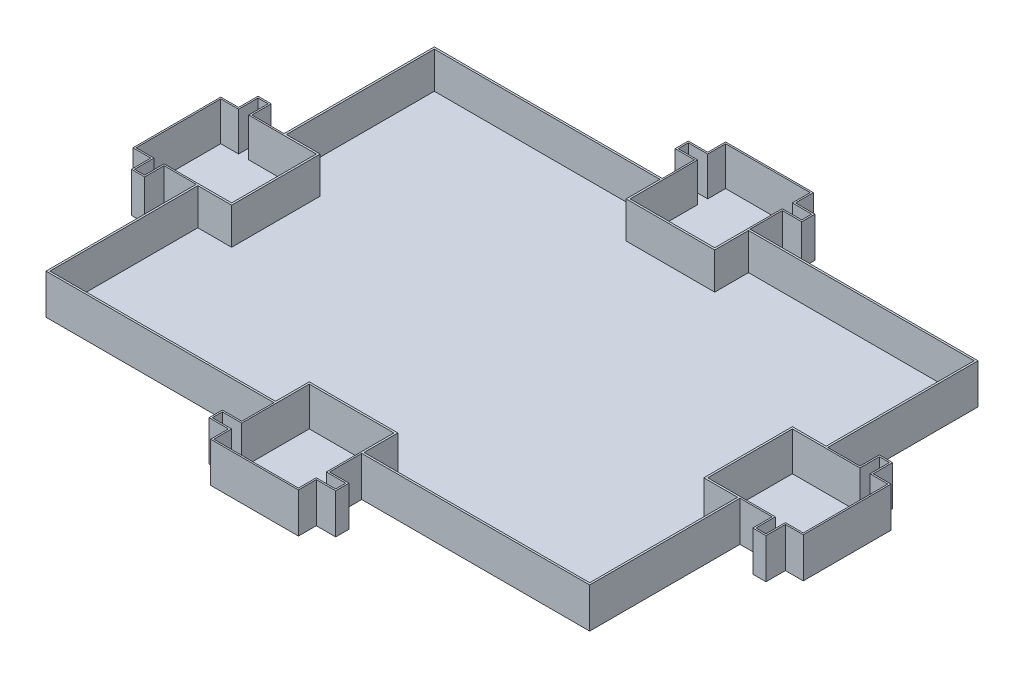
from build123d import *

# Parameters (mm, degrees)
SALIENTE_EXTRUIR1_DEPTH = 10
VACIADO2_START          = -40.8
VACIADO2_OUTLINE_W      = 121.6
VACIADO2_OUTLINE_H      = 9.4
VACIADO2_DEPTH          = 81.6
VACIADO2_START_2        = -49.5
VACIADO2_2_OUTLINE_W    = 49.4
VACIADO2_2_OUTLINE_H    = 9.4
VACIADO2_2_DEPTH        = 99
VACIADO2_3_OUTLINE_W    = 8.7
VACIADO2_3_OUTLINE_H    = 9.4
VACIADO2_3_DEPTH        = 38.1
VACIADO2_START_3        = 11.4
VACIADO2_4_OUTLINE_W    = 8.7
VACIADO2_4_OUTLINE_H    = 9.4
VACIADO2_4_DEPTH        = 38.1
SALIENTE_EXTRUIR6_DEPTH = 0.3


# Read off the part's stored shape, not the designer's step: Vaciado2
with BuildPart() as part:
    # Croquis1 → Saliente-Extruir1 (new body)
    with BuildSketch(Plane(origin=(0, 0, 0), x_dir=(1, 0, 0), z_dir=(0, 1, 0))):
        Polygon((-11.3, -50), (-11.3, -58.3), (-16.3, -58.3), (-16.3, -61.7), (-11.3, -61.7), (-11.3, -66.3), (11.3, -66.3), (11.3, -61.7), (16.3, -61.7), (16.3, -58.3), (11.3, -58.3), (11.3, -50), (70, -50), (70, -11.3), (78.3, -11.3), (78.3, -16.3), (81.7, -16.3), (81.7, -11.3), (86.3, -11.3), (86.3, 11.3), (81.7, 11.3), (81.7, 16.3), (78.3, 16.3), (78.3, 11.3), (70, 11.3), (70, 50), (11.3, 50), (11.3, 58.3), (16.3, 58.3), (16.3, 61.7), (11.3, 61.7), (11.3, 66.3), (-11.3, 66.3), (-11.3, 61.7), (-16.3, 61.7), (-16.3, 58.3), (-11.3, 58.3), (-11.3, 50), (-70, 50), (-70, 11.3), (-78.3, 11.3), (-78.3, 16.3), (-81.7, 16.3), (-81.7, 11.3), (-86.3, 11.3), (-86.3, -11.3), (-81.7, -11.3), (-81.7, -16.3), (-78.3, -16.3), (-78.3, -11.3), (-70, -11.3), (-70, -50), align=None)
        Polygon((-10.9, 41.3), (-10.9, 58.7), (-15.9, 58.7), (-15.9, 61.3), (-10.9, 61.3), (-10.9, 65.9), (10.9, 65.9), (10.9, 61.3), (15.9, 61.3), (15.9, 58.7), (10.9, 58.7), (10.9, 41.3), align=None, mode=Mode.SUBTRACT)
        Polygon((-10.9, -41.3), (10.9, -41.3), (10.9, -58.7), (15.9, -58.7), (15.9, -61.3), (10.9, -61.3), (10.9, -65.9), (-10.9, -65.9), (-10.9, -61.3), (-15.9, -61.3), (-15.9, -58.7), (-10.9, -58.7), align=None, mode=Mode.SUBTRACT)
        Polygon((-61.3, -10.9), (-78.7, -10.9), (-78.7, -15.9), (-81.3, -15.9), (-81.3, -10.9), (-85.9, -10.9), (-85.9, 10.9), (-81.3, 10.9), (-81.3, 15.9), (-78.7, 15.9), (-78.7, 10.9), (-61.3, 10.9), align=None, mode=Mode.SUBTRACT)
        Polygon((61.3, -10.9), (61.3, 10.9), (78.7, 10.9), (78.7, 15.9), (81.3, 15.9), (81.3, 10.9), (85.9, 10.9), (85.9, -10.9), (81.3, -10.9), (81.3, -15.9), (78.7, -15.9), (78.7, -10.9), align=None, mode=Mode.SUBTRACT)
    extrude(amount=-SALIENTE_EXTRUIR1_DEPTH)

    # Vaciado2 outline → Vaciado2 (cut)
    with BuildSketch(Plane.XY.offset(VACIADO2_START)):
        with Locations((0, -4.7)):
            Rectangle(VACIADO2_OUTLINE_W, VACIADO2_OUTLINE_H)
    extrude(amount=VACIADO2_DEPTH, mode=Mode.SUBTRACT)

    # Vaciado2 2 outline → Vaciado2 2 (cut)
    with BuildSketch(Plane.XY.offset(VACIADO2_START_2)):
        with Locations((-36.1, -4.7)):
            Rectangle(VACIADO2_2_OUTLINE_W, VACIADO2_2_OUTLINE_H)
        with Locations((36.1, -4.7)):
            Rectangle(VACIADO2_2_OUTLINE_W, VACIADO2_2_OUTLINE_H)
    extrude(amount=VACIADO2_2_DEPTH, mode=Mode.SUBTRACT)

    # Vaciado2 3 outline → Vaciado2 3 (cut)
    with BuildSketch(Plane.XY.offset(VACIADO2_START_2)):
        with Locations((-65.15, -4.7)):
            Rectangle(VACIADO2_3_OUTLINE_W, VACIADO2_3_OUTLINE_H)
        with Locations((65.15, -4.7)):
            Rectangle(VACIADO2_3_OUTLINE_W, VACIADO2_3_OUTLINE_H)
    extrude(amount=VACIADO2_3_DEPTH, mode=Mode.SUBTRACT)

    # Vaciado2 4 outline → Vaciado2 4 (cut)
    with BuildSketch(Plane.XY.offset(VACIADO2_START_3)):
        with Locations((-65.15, -4.7)):
            Rectangle(VACIADO2_4_OUTLINE_W, VACIADO2_4_OUTLINE_H)
        with Locations((65.15, -4.7)):
            Rectangle(VACIADO2_4_OUTLINE_W, VACIADO2_4_OUTLINE_H)
    extrude(amount=VACIADO2_4_DEPTH, mode=Mode.SUBTRACT)

    # Croquis4 → Saliente-Extruir6 (add)
    with BuildSketch(Plane.XZ.offset(10)):
        Polygon((-11.3, 50), (-70, 50), (-70, 11.3), (-78.3, 11.3), (-78.3, 16.3), (-81.7, 16.3), (-81.7, 11.3), (-86.3, 11.3), (-86.3, -11.3), (-81.7, -11.3), (-81.7, -16.3), (-78.3, -16.3), (-78.3, -11.3), (-70, -11.3), (-70, -50), (-11.3, -50), (-11.3, -58.3), (-16.3, -58.3), (-16.3, -61.7), (-11.3, -61.7), (-11.3, -66.3), (11.3, -66.3), (11.3, -61.7), (16.3, -61.7), (16.3, -58.3), (11.3, -58.3), (11.3, -50), (70, -50), (70, -11.3), (78.3, -11.3), (78.3, -16.3), (81.7, -16.3), (81.7, -11.3), (86.3, -11.3), (86.3, 11.3), (81.7, 11.3), (81.7, 16.3), (78.3, 16.3), (78.3, 11.3), (70, 11.3), (70, 50), (11.3, 50), (11.3, 58.3), (16.3, 58.3), (16.3, 61.7), (11.3, 61.7), (11.3, 66.3), (-11.3, 66.3), (-11.3, 61.7), (-16.3, 61.7), (-16.3, 58.3), (-11.3, 58.3), align=None)
    extrude(amount=SALIENTE_EXTRUIR6_DEPTH)


solid = part.part
